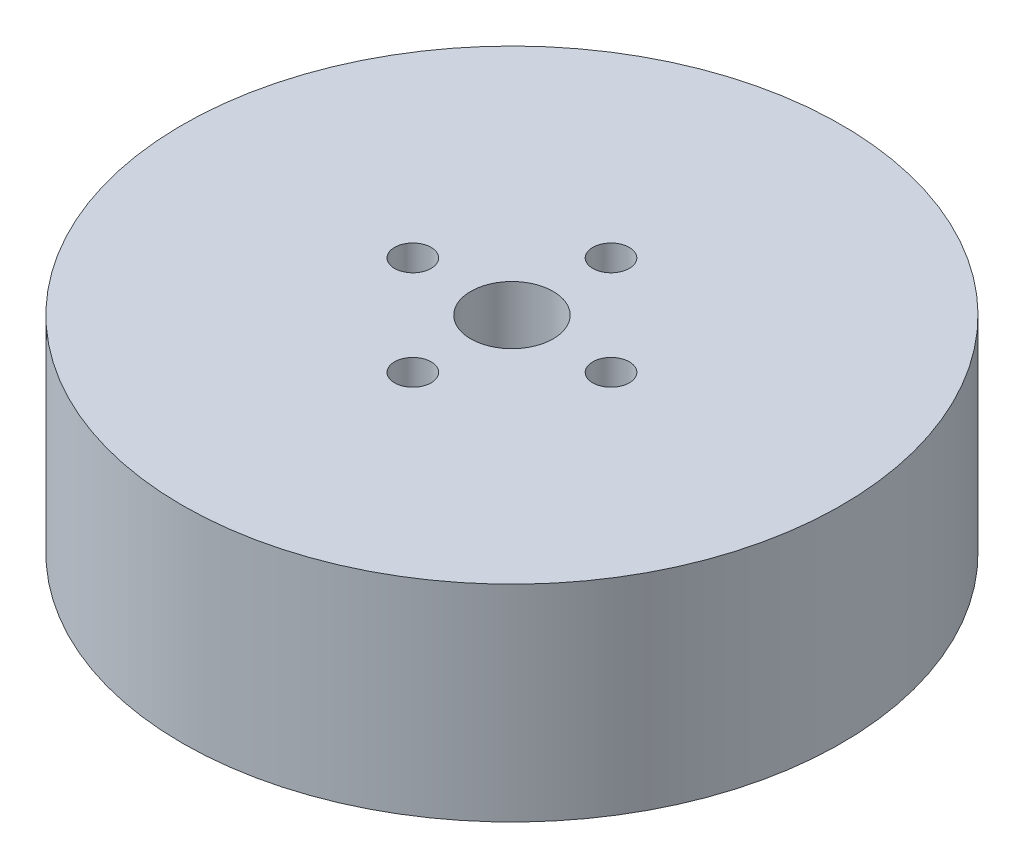
from build123d import *

# Parameters (mm, degrees)
SKETCH1_R           = 40
BOSS_EXTRUDE1_DEPTH = 25
SKETCH2_R           = 5
CUT_EXTRUDE1_DEPTH  = 62.846584384
SKETCH3_R           = 2.218400004
CUT_EXTRUDE2_DEPTH  = 18.74524742
CIRPATTERN1_COUNT   = 4


with BuildPart() as part:
    # Sketch1 → Boss-Extrude1 (new body)
    with BuildSketch(Plane(origin=(0, 0, 0), x_dir=(1, 0, 0), z_dir=(0, 1, 0))):
        Circle(SKETCH1_R)
    extrude(amount=BOSS_EXTRUDE1_DEPTH)

    # Sketch2 → Cut-Extrude1 (cut, through all)
    with BuildSketch(Plane(origin=(0, 0, 0), x_dir=(1, 0, 0), z_dir=(0, 1, 0))):
        Circle(SKETCH2_R)
    extrude(amount=CUT_EXTRUDE1_DEPTH, mode=Mode.SUBTRACT)

    # Sketch3 → Cut-Extrude2 (cut)
    with BuildSketch(Plane(origin=(0, 25, 0), x_dir=(1, 0, 0), z_dir=(0, 1, 0))):
        with Locations((-12.026302648, 0)):
            Circle(SKETCH3_R)
    cut_extrude2 = extrude(amount=-CUT_EXTRUDE2_DEPTH, mode=Mode.SUBTRACT)

    # CirPattern1: Cut-Extrude2 ×4 about axis
    cirpattern1_axis = Axis((0, 0, 0), (0, 1, 0))
    for i in range(1, CIRPATTERN1_COUNT):
        add(cut_extrude2.rotate(cirpattern1_axis, i * 360 / CIRPATTERN1_COUNT), mode=Mode.SUBTRACT)


solid = part.part
